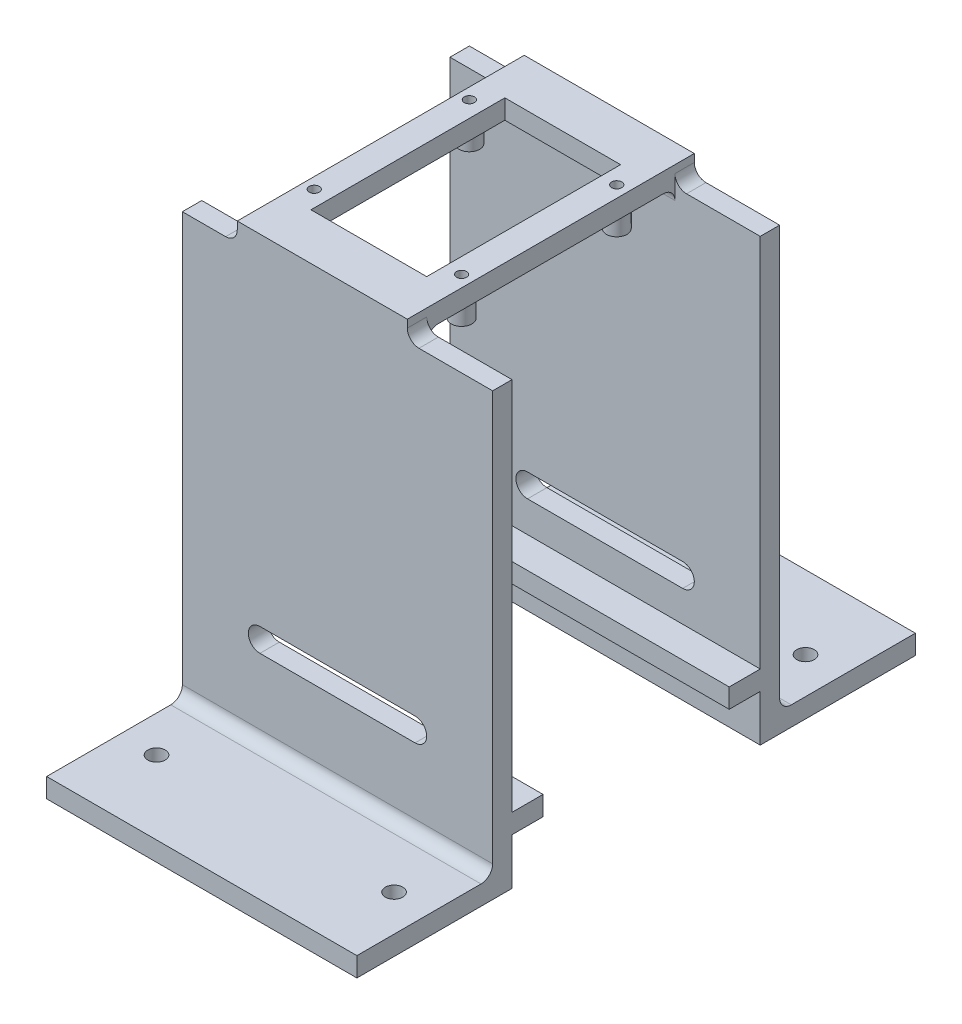
from build123d import *

# Parameters (mm, degrees)
SKETCH1_W             = 80
SKETCH1_H             = 40
SKETCH1_R             = 2.25
BOSS_EXTRUDE1_DEPTH   = 5
BOSS_EXTRUDE1_2_DEPTH = 5
SKETCH2_W             = 80
SKETCH2_H             = 5
BOSS_EXTRUDE2_DEPTH   = 108.62
SKETCH3_W             = 43.85
SKETCH3_H             = 74
BOSS_EXTRUDE3_DEPTH   = 5
SKETCH5_W             = 29.85
SKETCH5_H             = 50
CUT_EXTRUDE2_DEPTH    = 10
CUT_EXTRUDE1_REACH    = 146.412
SKETCH4_R             = 1.3
FILLET1_R             = 3
FILLET2_R             = 3
SKETCH9_R             = 2.65
SKETCH9_R_2           = 1.05
BOSS_EXTRUDE5_DEPTH   = 4.75
SKETCH10_W            = 12
SKETCH10_H            = 6.8
CUT_EXTRUDE4_DEPTH    = 8
SKETCH11_W            = 80
SKETCH11_H            = 5
BOSS_EXTRUDE6_DEPTH   = 8
CUT_EXTRUDE5_REACH    = 167.987


with BuildPart() as part:
    # Sketch1 → Boss-Extrude1 (new body)
    with BuildSketch(Plane(origin=(0, 0, 0), x_dir=(1, 0, 0), z_dir=(0, 1, 0))):
        with Locations((0, 52)):
            Rectangle(SKETCH1_W, SKETCH1_H)
        with Locations((-30.625, 53.044055982)):
            Circle(SKETCH1_R, mode=Mode.SUBTRACT)
        with Locations((30.625, 53.044055982)):
            Circle(SKETCH1_R, mode=Mode.SUBTRACT)
    extrude(amount=BOSS_EXTRUDE1_DEPTH)



with BuildPart() as body_2:
    # Sketch1 → Boss-Extrude1 2 (new body)
    with BuildSketch(Plane(origin=(0, 0, 0), x_dir=(1, 0, 0), z_dir=(0, 1, 0))):
        with Locations((0, -52)):
            Rectangle(SKETCH1_W, SKETCH1_H)
        with Locations((30.625, -53.044055982)):
            Circle(SKETCH1_R, mode=Mode.SUBTRACT)
        with Locations((-30.625, -53.044055982)):
            Circle(SKETCH1_R, mode=Mode.SUBTRACT)
    extrude(amount=BOSS_EXTRUDE1_2_DEPTH)


with BuildPart() as part_1:
    add(part.part)

    add(body_2.part)  # Boss-Extrude2 merges body 2
    # Sketch2 → Boss-Extrude2 (add)
    with BuildSketch(Plane(origin=(0, 5, 0), x_dir=(1, 0, 0), z_dir=(0, 1, 0))):
        with Locations((0, 34.5)):
            Rectangle(SKETCH2_W, SKETCH2_H)
        with Locations((0, -34.5)):
            Rectangle(SKETCH2_W, SKETCH2_H)
    extrude(amount=BOSS_EXTRUDE2_DEPTH)

    # Sketch3 → Boss-Extrude3 (add)
    with BuildSketch(Plane(origin=(0, 113.62, 0), x_dir=(1, 0, 0), z_dir=(0, 1, 0))):
        with Locations((-3.925, 0)):
            Rectangle(SKETCH3_W, SKETCH3_H)
    extrude(amount=BOSS_EXTRUDE3_DEPTH)

    # Sketch5 → Cut-Extrude2 (cut)
    with BuildSketch(Plane.XZ.offset(-113.62)):
        with Locations((-3.925, 0)):
            Rectangle(SKETCH5_W, SKETCH5_H)
    extrude(amount=-CUT_EXTRUDE2_DEPTH, mode=Mode.SUBTRACT)

    # Sketch4 → Cut-Extrude1 (cut, up to next)
    with BuildSketch(Plane(origin=(0, 118.62, 0), x_dir=(1, 0, 0), z_dir=(0, 1, 0)), mode=Mode.PRIVATE) as cut_extrude1_sk1:
        with Locations((-23, 20)):
            Circle(SKETCH4_R)
    cut_extrude1_tool1 = extrude(cut_extrude1_sk1.sketch, amount=-CUT_EXTRUDE1_REACH, mode=Mode.PRIVATE) & part_1.part
    # Sketch4 → Cut-Extrude1 (cut, up to next)
    with BuildSketch(Plane(origin=(0, 118.62, 0), x_dir=(1, 0, 0), z_dir=(0, 1, 0)), mode=Mode.PRIVATE) as cut_extrude1_sk2:
        with Locations((15, 20)):
            Circle(SKETCH4_R)
    cut_extrude1_tool2 = extrude(cut_extrude1_sk2.sketch, amount=-CUT_EXTRUDE1_REACH, mode=Mode.PRIVATE) & part_1.part
    # Sketch4 → Cut-Extrude1 (cut, up to next)
    with BuildSketch(Plane(origin=(0, 118.62, 0), x_dir=(1, 0, 0), z_dir=(0, 1, 0)), mode=Mode.PRIVATE) as cut_extrude1_sk3:
        with Locations((15, -20)):
            Circle(SKETCH4_R)
    cut_extrude1_tool3 = extrude(cut_extrude1_sk3.sketch, amount=-CUT_EXTRUDE1_REACH, mode=Mode.PRIVATE) & part_1.part
    # Sketch4 → Cut-Extrude1 (cut, up to next)
    with BuildSketch(Plane(origin=(0, 118.62, 0), x_dir=(1, 0, 0), z_dir=(0, 1, 0)), mode=Mode.PRIVATE) as cut_extrude1_sk4:
        with Locations((-23, -20)):
            Circle(SKETCH4_R)
    cut_extrude1_tool4 = extrude(cut_extrude1_sk4.sketch, amount=-CUT_EXTRUDE1_REACH, mode=Mode.PRIVATE) & part_1.part
    add(cut_extrude1_tool1.solids().sort_by_distance((-23, 118.62, -20))[0], mode=Mode.SUBTRACT)
    add(cut_extrude1_tool2.solids().sort_by_distance((15, 118.62, -20))[0], mode=Mode.SUBTRACT)
    add(cut_extrude1_tool3.solids().sort_by_distance((15, 118.62, 20))[0], mode=Mode.SUBTRACT)
    add(cut_extrude1_tool4.solids().sort_by_distance((-23, 118.62, 20))[0], mode=Mode.SUBTRACT)

    # Fillet1
    fillet1_edges = [part_1.edges().sort_by_distance(p)[0] for p in [
        (-3.925, 113.62, -32),
        (-3.925, 113.62, 32),
        (0, 5, -37),
        (0, 5, 37),
    ]]
    fillet(fillet1_edges, radius=FILLET1_R)

    # Fillet2
    fillet2_edges = [part_1.edges().sort_by_distance(p)[0] for p in [
        (18, 113.62, -34.5),
        (-25.85, 113.62, -34.5),
        (-25.85, 113.62, 34.5),
        (18, 113.62, 34.5),
    ]]
    fillet(fillet2_edges, radius=FILLET2_R)

    # Sketch9 → Boss-Extrude5 (add)
    # profile 1 of 4: a face of its own
    with BuildSketch(Plane.XZ.offset(-113.62)):
        with Locations((-23, 20)):
            Circle(SKETCH9_R)
        with Locations((-23, 20)):
            Circle(SKETCH9_R_2, mode=Mode.SUBTRACT)
    # profile 2 of 4: a face of its own
    with BuildSketch(Plane.XZ.offset(-113.62)):
        with Locations((-23, -20)):
            Circle(SKETCH9_R)
        with Locations((-23, -20)):
            Circle(SKETCH9_R_2, mode=Mode.SUBTRACT)
    # profile 3 of 4: a face of its own
    with BuildSketch(Plane.XZ.offset(-113.62)):
        with Locations((15, 20)):
            Circle(SKETCH9_R)
        with Locations((15, 20)):
            Circle(SKETCH9_R_2, mode=Mode.SUBTRACT)
    # profile 4 of 4: a face of its own
    with BuildSketch(Plane.XZ.offset(-113.62)):
        with Locations((15, -20)):
            Circle(SKETCH9_R)
        with Locations((15, -20)):
            Circle(SKETCH9_R_2, mode=Mode.SUBTRACT)
    extrude(amount=BOSS_EXTRUDE5_DEPTH)

    # Sketch10 → Cut-Extrude4 (cut)
    with BuildSketch(Plane.XY.offset(37)):
        with Locations((6.7, 110.77)):
            Rectangle(SKETCH10_W, SKETCH10_H)
    extrude(amount=-CUT_EXTRUDE4_DEPTH, mode=Mode.SUBTRACT)

    # Sketch11 → Boss-Extrude6 (add)
    with BuildSketch(Plane(origin=(0, 0, 32), x_dir=(-1, 0, 0), z_dir=(0, 0, -1))):
        with Locations((0, 14.5)):
            Rectangle(SKETCH11_W, SKETCH11_H)
    extrude(amount=BOSS_EXTRUDE6_DEPTH)

    # Mirror3: part across plane


with BuildPart() as part_2:
    add(part_1.part)
    add(part_1.part.mirror(Plane.XY))

    # Sketch12 → Cut-Extrude5 (cut, up to next)
    with BuildSketch(Plane(origin=(0, 0, -37), x_dir=(-1, 0, 0), z_dir=(0, 0, -1)), mode=Mode.PRIVATE) as cut_extrude5_sk1:
        with BuildLine():
            Line((20, 25), (-20, 25))
            ThreePointArc((-20, 25), (-23, 28), (-20, 31))
            Line((-20, 31), (20, 31))
            ThreePointArc((20, 31), (23, 28), (20, 25))
        make_face()
    cut_extrude5_tool1 = extrude(cut_extrude5_sk1.sketch, amount=-CUT_EXTRUDE5_REACH, mode=Mode.PRIVATE) & part_2.part
    cut_extrude5 = cut_extrude5_tool1.solids().sort_by_distance((0, 28, -37))[0]
    add(cut_extrude5, mode=Mode.SUBTRACT)

    # Mirror4: Cut-Extrude5 across plane
    add(cut_extrude5.mirror(Plane.XY), mode=Mode.SUBTRACT)


solid = part_2.part
